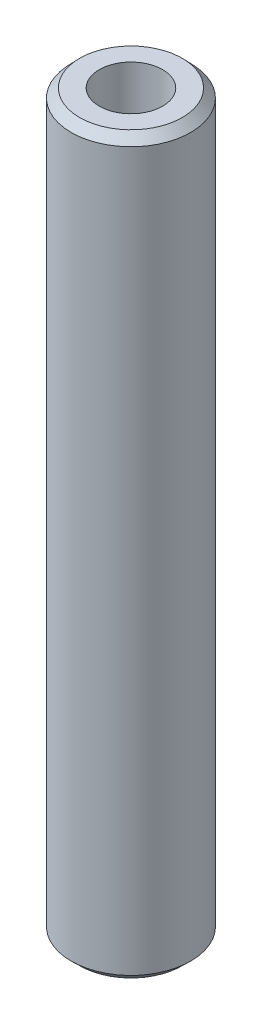
from build123d import *
from OCP.BRepFilletAPI import BRepFilletAPI_MakeChamfer

# Parameters (mm, degrees)
SKETCH1_R           = 7.5
BOSS_EXTRUDE1_DEPTH = 92.241985387
SKETCH2_R           = 3.979058266
CUT_EXTRUDE1_DEPTH  = 93.849791966
CHAMFER1_SIZE       = 1.097418837
CHAMFER1_SIZE2      = 1.056754254


with BuildPart() as part:
    # Sketch1 → Boss-Extrude1 (new body)
    with BuildSketch(Plane(origin=(0, 0, 0), x_dir=(1, 0, 0), z_dir=(0, 1, 0))):
        Circle(SKETCH1_R)
    extrude(amount=BOSS_EXTRUDE1_DEPTH)

    # Sketch2 → Cut-Extrude1 (cut, through all)
    with BuildSketch(Plane(origin=(0, 0, 0), x_dir=(1, 0, 0), z_dir=(0, 1, 0))):
        Circle(SKETCH2_R)
    extrude(amount=CUT_EXTRUDE1_DEPTH, mode=Mode.SUBTRACT)

    # Chamfer1: one chamfer whose edges measure the first distance from different faces: ONE call of the kernel's chamfer builder (chamfer() names one face for all edges)
    chamfer1_edges_1 = [part.edges().sort_by_distance(p)[0] for p in [
        (-7.5, 92.241985387, 0),
    ]]
    chamfer1_side_1 = [part.faces().sort_by_distance(p)[0] for p in [
        (-7.5, 46.120992694, 0),
    ]]
    chamfer1_edges_2 = [part.edges().sort_by_distance(p)[0] for p in [
        (-7.5, 0, 0),
    ]]
    chamfer1_side_2 = [part.faces().sort_by_distance(p)[0] for p in [
        (-7.287867966, 0, 0),
    ]]
    chamfer1 = BRepFilletAPI_MakeChamfer(part.part.solid().wrapped)
    for e in chamfer1_edges_1:
        chamfer1.Add(CHAMFER1_SIZE, CHAMFER1_SIZE2, e.wrapped, chamfer1_side_1[0].wrapped)  # the first distance lies on this face
    for e in chamfer1_edges_2:
        chamfer1.Add(CHAMFER1_SIZE, CHAMFER1_SIZE2, e.wrapped, chamfer1_side_2[0].wrapped)  # the first distance lies on this face
    add(Compound.cast(chamfer1.Shape()), mode=Mode.REPLACE)


solid = part.part
